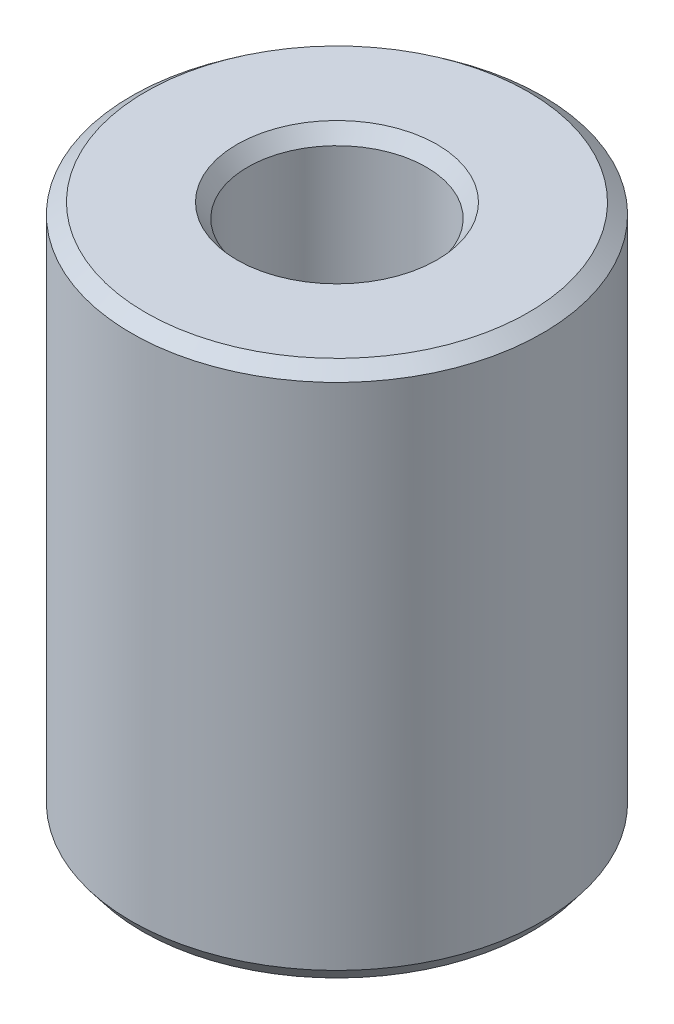
from build123d import *
from OCP.BRepFilletAPI import BRepFilletAPI_MakeChamfer

# Parameters (mm, degrees)
SKETCH1_R           = 57.5
BOSS_EXTRUDE1_DEPTH = 149.476880737
SKETCH2_R           = 24.976750593
CUT_EXTRUDE1_DEPTH  = 171.164149793
CHAMFER1_SIZE       = 3.023268425
CHAMFER1_SIZE2      = 3.969440916


with BuildPart() as part:
    # Sketch1 → Boss-Extrude1 (new body)
    with BuildSketch(Plane(origin=(0, 0, 0), x_dir=(1, 0, 0), z_dir=(0, 1, 0))):
        Circle(SKETCH1_R)
    extrude(amount=BOSS_EXTRUDE1_DEPTH)

    # Sketch2 → Cut-Extrude1 (cut, through all)
    with BuildSketch(Plane(origin=(0, 0, 0), x_dir=(1, 0, 0), z_dir=(0, 1, 0))):
        Circle(SKETCH2_R)
    extrude(amount=CUT_EXTRUDE1_DEPTH, mode=Mode.SUBTRACT)

    # Chamfer1: one chamfer whose edges measure the first distance from different faces: ONE call of the kernel's chamfer builder (chamfer() names one face for all edges)
    chamfer1_edges_1 = [part.edges().sort_by_distance(p)[0] for p in [
        (-24.976750593, 149.476880737, 0),
    ]]
    chamfer1_side_1 = [part.faces().sort_by_distance(p)[0] for p in [
        (-55.873654403, 149.476880737, 0),
    ]]
    chamfer1_edges_2 = [part.edges().sort_by_distance(p)[0] for p in [
        (-24.976750593, 0, 0),
    ]]
    chamfer1_side_2 = [part.faces().sort_by_distance(p)[0] for p in [
        (-24.976750593, 74.738440369, 0),
    ]]
    chamfer1_edges_3 = [part.edges().sort_by_distance(p)[0] for p in [
        (-57.5, 0, 0),
    ]]
    chamfer1_side_3 = [part.faces().sort_by_distance(p)[0] for p in [
        (-55.873654403, 0, 0),
    ]]
    chamfer1_edges_4 = [part.edges().sort_by_distance(p)[0] for p in [
        (-57.5, 149.476880737, 0),
    ]]
    chamfer1_side_4 = [part.faces().sort_by_distance(p)[0] for p in [
        (-57.5, 74.738440369, 0),
    ]]
    chamfer1 = BRepFilletAPI_MakeChamfer(part.part.solid().wrapped)
    for e in chamfer1_edges_1:
        chamfer1.Add(CHAMFER1_SIZE, CHAMFER1_SIZE2, e.wrapped, chamfer1_side_1[0].wrapped)  # the first distance lies on this face
    for e in chamfer1_edges_2:
        chamfer1.Add(CHAMFER1_SIZE, CHAMFER1_SIZE2, e.wrapped, chamfer1_side_2[0].wrapped)  # the first distance lies on this face
    for e in chamfer1_edges_3:
        chamfer1.Add(CHAMFER1_SIZE, CHAMFER1_SIZE2, e.wrapped, chamfer1_side_3[0].wrapped)  # the first distance lies on this face
    for e in chamfer1_edges_4:
        chamfer1.Add(CHAMFER1_SIZE, CHAMFER1_SIZE2, e.wrapped, chamfer1_side_4[0].wrapped)  # the first distance lies on this face
    add(Compound.cast(chamfer1.Shape()), mode=Mode.REPLACE)


solid = part.part
